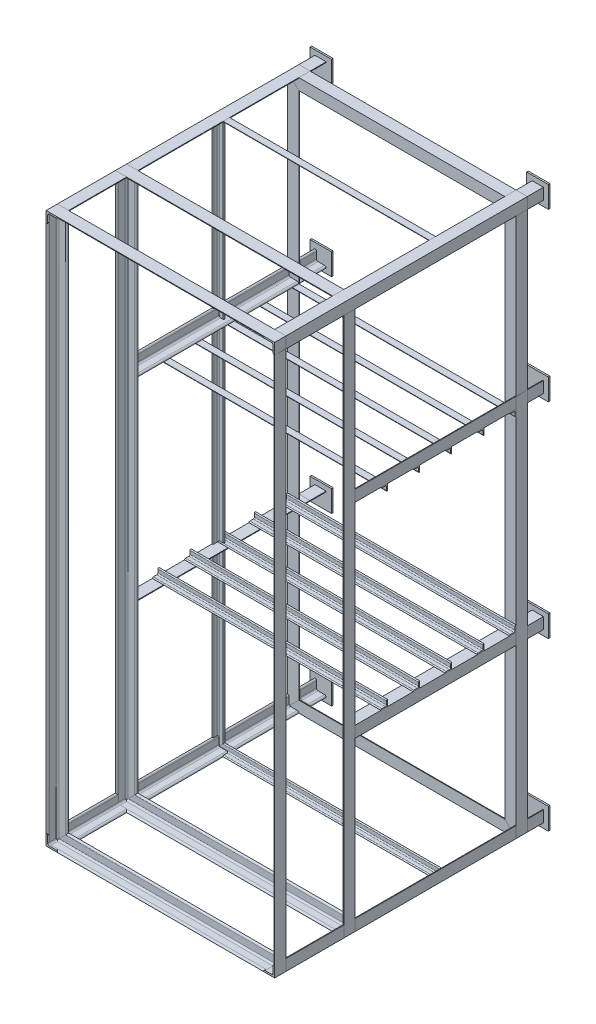
from build123d import *

# Parameters (mm, degrees)
ANGLE_IRON_35_X_35_X_5_3_DEPTH      = 795.497474683
ANGLE_IRON_35_X_35_X_5_3_DEPTH_BACK = 85.497474683
ANGLE_IRON_35_X_35_X_5_3_2_DEPTH    = 1880.994949366
ANGLE_IRON_35_X_35_X_5_3_3_DEPTH    = 880.994949366
ANGLE_IRON_35_X_35_X_5_3_4_DEPTH    = 1880.994949366
ANGLE_IRON_35_X_35_X_5_4_DEPTH      = 760.497474683
ANGLE_IRON_35_X_35_X_5_4_DEPTH_BACK = 50.497474683
ANGLE_IRON_35_X_35_X_5_4_2_DEPTH    = 1810.994949366
ANGLE_IRON_35_X_35_X_5_4_3_DEPTH    = 810.994949366
ANGLE_IRON_35_X_35_X_5_4_4_DEPTH    = 1810.994949366
ANGLE_IRON_35_X_35_X_5_5_DEPTH      = 1795.497474683
ANGLE_IRON_35_X_35_X_5_5_DEPTH_BACK = 85.497474683
ANGLE_IRON_35_X_35_X_5_5_2_DEPTH    = 880.994949366
ANGLE_IRON_35_X_35_X_5_5_3_DEPTH    = 1880.994949366
ANGLE_IRON_35_X_35_X_5_5_4_DEPTH    = 880.994949366
ANGLE_IRON_35_X_35_X_5_6_DEPTH      = 785
ANGLE_IRON_35_X_35_X_5_8_DEPTH      = 785
ANGLE_IRON_35_X_35_X_5_9_DEPTH      = 50
ANGLE_IRON_35_X_35_X_5_9_2_DEPTH    = 785
ANGLE_IRON_35_X_35_X_5_10_DEPTH     = 50
ANGLE_IRON_35_X_35_X_5_10_2_DEPTH   = 785
ANGLE_IRON_35_X_35_X_5_11_DEPTH     = 50
ANGLE_IRON_35_X_35_X_5_12_DEPTH     = 50
ANGLE_IRON_35_X_35_X_5_13_DEPTH     = 50
ANGLE_IRON_35_X_35_X_5_13_2_DEPTH   = 535
ANGLE_IRON_35_X_35_X_5_14_DEPTH     = 50
ANGLE_IRON_35_X_35_X_5_14_2_DEPTH   = 535
ANGLE_IRON_35_X_35_X_5_15_DEPTH     = 50
ANGLE_IRON_35_X_35_X_5_15_2_DEPTH   = 535
ANGLE_IRON_35_X_35_X_5_16_DEPTH     = 535
ANGLE_IRON_35_X_35_X_5_16_2_DEPTH   = 50
ANGLE_IRON_20_X_20_X_3_1_DEPTH      = 739.284271247
ANGLE_IRON_20_X_20_X_3_1_2_DEPTH    = 1768.568542495
ANGLE_IRON_20_X_20_X_3_1_3_DEPTH    = 739.284271247
ANGLE_IRON_20_X_20_X_3_2_DEPTH      = 710
ANGLE_IRON_20_X_20_X_3_2_2_DEPTH    = 710
ANGLE_IRON_20_X_20_X_3_2_3_DEPTH    = 710
ANGLE_IRON_20_X_20_X_3_2_4_DEPTH    = 710
ANGLE_IRON_20_X_20_X_3_2_5_DEPTH    = 710
ANGLE_IRON_20_X_20_X_3_3_DEPTH      = 710
ANGLE_IRON_20_X_20_X_3_3_2_DEPTH    = 710
ANGLE_IRON_20_X_20_X_3_3_3_DEPTH    = 710
ANGLE_IRON_20_X_20_X_3_3_4_DEPTH    = 710
ANGLE_IRON_20_X_20_X_3_3_5_DEPTH    = 710
SKETCH127_W                         = 67
SKETCH127_H                         = 67
BOSS_EXTRUDE1_DEPTH                 = 5
SKETCH129_W                         = 67
SKETCH129_H                         = 67
BOSS_EXTRUDE2_DEPTH                 = 5
SKETCH130_W                         = 67
SKETCH130_H                         = 67
BOSS_EXTRUDE3_DEPTH                 = 5
SKETCH131_W                         = 67
SKETCH131_H                         = 67
BOSS_EXTRUDE4_DEPTH                 = 5


with BuildPart() as part:
    # Sketch1 → Angle iron 35 X 35 X 5(3) (new, two sides: drawn at the far end of the back side and taken through both)
    with BuildSketch(Plane(origin=(355, -855, 750), x_dir=(0, 0, 1), z_dir=(-1, 0, 0)).offset(-ANGLE_IRON_35_X_35_X_5_3_DEPTH_BACK)):
        with BuildLine():
            Line((0, 0), (0, 35))
            ThreePointArc((0, 35), (3.535533906, 33.535533906), (5, 30))
            Line((5, 30), (5, 10))
            ThreePointArc((5, 10), (6.464466094, 6.464466094), (10, 5))
            Line((10, 5), (30, 5))
            ThreePointArc((30, 5), (33.535533906, 3.535533906), (35, 0))
            Line((35, 0), (0, 0))
        make_face()
    extrude(amount=ANGLE_IRON_35_X_35_X_5_3_DEPTH + ANGLE_IRON_35_X_35_X_5_3_DEPTH_BACK)

    # Angle iron 35 X 35 X 5(3) mitre 1
    split(bisect_by=Plane(origin=(355, -855, 785), x_dir=(0.707106781, -0.707106781, 0), z_dir=(-0.707106781, -0.707106781, 0)), keep=Keep.TOP)

    # Angle iron 35 X 35 X 5(3) mitre 2
    split(bisect_by=Plane(origin=(-355, -855, 785), x_dir=(0.707106781, 0.707106781, 0), z_dir=(0.707106781, -0.707106781, 0)), keep=Keep.TOP)


with BuildPart() as body_2:
    # Sketch1 on segment 2 (carried to segment 2) → Angle iron 35 X 35 X 5_3 2 (new body)
    with BuildSketch(Plane(origin=(-355, -940.497474683, 750), x_dir=(0, 0, 1), z_dir=(0, 1, 0))):
        with BuildLine():
            Line((0, 0), (0, 35))
            ThreePointArc((0, 35), (3.535533906, 33.535533906), (5, 30))
            Line((5, 30), (5, 10))
            ThreePointArc((5, 10), (6.464466094, 6.464466094), (10, 5))
            Line((10, 5), (30, 5))
            ThreePointArc((30, 5), (33.535533906, 3.535533906), (35, 0))
            Line((35, 0), (0, 0))
        make_face()
    extrude(amount=ANGLE_IRON_35_X_35_X_5_3_2_DEPTH)

    # Angle iron 35 X 35 X 5_3 2 mitre 1
    split(bisect_by=Plane(origin=(-355, 855, 785), x_dir=(0.707106781, -0.707106781, 0), z_dir=(-0.707106781, -0.707106781, 0)), keep=Keep.TOP)

    # Angle iron 35 X 35 X 5_3 2 mitre 2
    split(bisect_by=Plane(origin=(-355, -855, 785), x_dir=(-0.707106781, -0.707106781, 0), z_dir=(-0.707106781, 0.707106781, 0)), keep=Keep.TOP)


with BuildPart() as body_3:
    # Sketch1 on segment 3 (carried to segment 3) → Angle iron 35 X 35 X 5_3 3 (new body)
    with BuildSketch(Plane(origin=(-440.497474683, 855, 750), x_dir=(0, 0, 1), z_dir=(1, 0, 0))):
        with BuildLine():
            Line((0, 0), (0, 35))
            ThreePointArc((0, 35), (3.535533906, 33.535533906), (5, 30))
            Line((5, 30), (5, 10))
            ThreePointArc((5, 10), (6.464466094, 6.464466094), (10, 5))
            Line((10, 5), (30, 5))
            ThreePointArc((30, 5), (33.535533906, 3.535533906), (35, 0))
            Line((35, 0), (0, 0))
        make_face()
    extrude(amount=ANGLE_IRON_35_X_35_X_5_3_3_DEPTH)

    # Angle iron 35 X 35 X 5_3 3 mitre 1
    split(bisect_by=Plane(origin=(355, 855, 785), x_dir=(-0.707106781, -0.707106781, 0), z_dir=(-0.707106781, 0.707106781, 0)), keep=Keep.TOP)

    # Angle iron 35 X 35 X 5_3 3 mitre 2
    split(bisect_by=Plane(origin=(-355, 855, 785), x_dir=(-0.707106781, 0.707106781, 0), z_dir=(0.707106781, 0.707106781, 0)), keep=Keep.TOP)


with BuildPart() as body_4:
    # Sketch1 on segment 4 (carried to segment 4) → Angle iron 35 X 35 X 5_3 4 (new body)
    with BuildSketch(Plane(origin=(355, 940.497474683, 750), x_dir=(0, 0, 1), z_dir=(0, -1, 0))):
        with BuildLine():
            Line((0, 0), (0, 35))
            ThreePointArc((0, 35), (3.535533906, 33.535533906), (5, 30))
            Line((5, 30), (5, 10))
            ThreePointArc((5, 10), (6.464466094, 6.464466094), (10, 5))
            Line((10, 5), (30, 5))
            ThreePointArc((30, 5), (33.535533906, 3.535533906), (35, 0))
            Line((35, 0), (0, 0))
        make_face()
    extrude(amount=ANGLE_IRON_35_X_35_X_5_3_4_DEPTH)

    # Angle iron 35 X 35 X 5_3 4 mitre 1
    split(bisect_by=Plane(origin=(355, -855, 785), x_dir=(-0.707106781, 0.707106781, 0), z_dir=(0.707106781, 0.707106781, 0)), keep=Keep.TOP)

    # Angle iron 35 X 35 X 5_3 4 mitre 2
    split(bisect_by=Plane(origin=(355, 855, 785), x_dir=(0.707106781, 0.707106781, 0), z_dir=(0.707106781, -0.707106781, 0)), keep=Keep.TOP)


with BuildPart() as body_5:
    # Sketch17 → Angle iron 35 X 35 X 5(4) (new, two sides: drawn at the far end of the back side and taken through both)
    with BuildSketch(Plane(origin=(-355, -855, 535), x_dir=(0, 1, 0), z_dir=(1, 0, 0)).offset(-ANGLE_IRON_35_X_35_X_5_4_DEPTH_BACK)):
        with BuildLine():
            Line((0, 0), (0, 35))
            ThreePointArc((0, 35), (3.535533906, 33.535533906), (5, 30))
            Line((5, 30), (5, 10))
            ThreePointArc((5, 10), (6.464466094, 6.464466094), (10, 5))
            Line((10, 5), (30, 5))
            ThreePointArc((30, 5), (33.535533906, 3.535533906), (35, 0))
            Line((35, 0), (0, 0))
        make_face()
    extrude(amount=ANGLE_IRON_35_X_35_X_5_4_DEPTH + ANGLE_IRON_35_X_35_X_5_4_DEPTH_BACK)

    # Angle iron 35 X 35 X 5(4) mitre 1
    split(bisect_by=Plane(origin=(-355, -855, 535), x_dir=(0.707106781, 0.707106781, 0), z_dir=(0.707106781, -0.707106781, 0)), keep=Keep.TOP)

    # Angle iron 35 X 35 X 5(4) mitre 2
    split(bisect_by=Plane(origin=(355, -855, 535), x_dir=(0.707106781, -0.707106781, 0), z_dir=(-0.707106781, -0.707106781, 0)), keep=Keep.TOP)


with BuildPart() as body_6:
    # Sketch17 on segment 2 (carried to segment 2) → Angle iron 35 X 35 X 5_4 2 (new body)
    with BuildSketch(Plane(origin=(355, -905.497474683, 535), x_dir=(-1, 0, 0), z_dir=(0, 1, 0))):
        with BuildLine():
            Line((0, 0), (0, 35))
            ThreePointArc((0, 35), (3.535533906, 33.535533906), (5, 30))
            Line((5, 30), (5, 10))
            ThreePointArc((5, 10), (6.464466094, 6.464466094), (10, 5))
            Line((10, 5), (30, 5))
            ThreePointArc((30, 5), (33.535533906, 3.535533906), (35, 0))
            Line((35, 0), (0, 0))
        make_face()
    extrude(amount=ANGLE_IRON_35_X_35_X_5_4_2_DEPTH)

    # Angle iron 35 X 35 X 5_4 2 mitre 1
    split(bisect_by=Plane(origin=(355, -855, 535), x_dir=(-0.707106781, 0.707106781, 0), z_dir=(0.707106781, 0.707106781, 0)), keep=Keep.TOP)

    # Angle iron 35 X 35 X 5_4 2 mitre 2
    split(bisect_by=Plane(origin=(355, 855, 535), x_dir=(0.707106781, 0.707106781, 0), z_dir=(0.707106781, -0.707106781, 0)), keep=Keep.TOP)


with BuildPart() as body_7:
    # Sketch17 on segment 3 (carried to segment 3) → Angle iron 35 X 35 X 5_4 3 (new body)
    with BuildSketch(Plane(origin=(405.497474683, 855, 535), x_dir=(0, -1, 0), z_dir=(-1, 0, 0))):
        with BuildLine():
            Line((0, 0), (0, 35))
            ThreePointArc((0, 35), (3.535533906, 33.535533906), (5, 30))
            Line((5, 30), (5, 10))
            ThreePointArc((5, 10), (6.464466094, 6.464466094), (10, 5))
            Line((10, 5), (30, 5))
            ThreePointArc((30, 5), (33.535533906, 3.535533906), (35, 0))
            Line((35, 0), (0, 0))
        make_face()
    extrude(amount=ANGLE_IRON_35_X_35_X_5_4_3_DEPTH)

    # Angle iron 35 X 35 X 5_4 3 mitre 1
    split(bisect_by=Plane(origin=(355, 855, 535), x_dir=(-0.707106781, -0.707106781, 0), z_dir=(-0.707106781, 0.707106781, 0)), keep=Keep.TOP)

    # Angle iron 35 X 35 X 5_4 3 mitre 2
    split(bisect_by=Plane(origin=(-355, 855, 535), x_dir=(-0.707106781, 0.707106781, 0), z_dir=(0.707106781, 0.707106781, 0)), keep=Keep.TOP)


with BuildPart() as body_8:
    # Sketch17 on segment 4 (carried to segment 4) → Angle iron 35 X 35 X 5_4 4 (new body)
    with BuildSketch(Plane(origin=(-355, 905.497474683, 535), x_dir=(1, 0, 0), z_dir=(0, -1, 0))):
        with BuildLine():
            Line((0, 0), (0, 35))
            ThreePointArc((0, 35), (3.535533906, 33.535533906), (5, 30))
            Line((5, 30), (5, 10))
            ThreePointArc((5, 10), (6.464466094, 6.464466094), (10, 5))
            Line((10, 5), (30, 5))
            ThreePointArc((30, 5), (33.535533906, 3.535533906), (35, 0))
            Line((35, 0), (0, 0))
        make_face()
    extrude(amount=ANGLE_IRON_35_X_35_X_5_4_4_DEPTH)

    # Angle iron 35 X 35 X 5_4 4 mitre 1
    split(bisect_by=Plane(origin=(-355, 855, 535), x_dir=(0.707106781, -0.707106781, 0), z_dir=(-0.707106781, -0.707106781, 0)), keep=Keep.TOP)

    # Angle iron 35 X 35 X 5_4 4 mitre 2
    split(bisect_by=Plane(origin=(-355, -855, 535), x_dir=(-0.707106781, -0.707106781, 0), z_dir=(-0.707106781, 0.707106781, 0)), keep=Keep.TOP)


with BuildPart() as body_9:
    # Sketch18 → Angle iron 35 X 35 X 5(5) (new, two sides: drawn at the far end of the back side and taken through both)
    with BuildSketch(Plane(origin=(355, -855, 35), x_dir=(0, 0, -1), z_dir=(0, 1, 0)).offset(-ANGLE_IRON_35_X_35_X_5_5_DEPTH_BACK)):
        with BuildLine():
            Line((0, 0), (0, 35))
            ThreePointArc((0, 35), (3.535533906, 33.535533906), (5, 30))
            Line((5, 30), (5, 10))
            ThreePointArc((5, 10), (6.464466094, 6.464466094), (10, 5))
            Line((10, 5), (30, 5))
            ThreePointArc((30, 5), (33.535533906, 3.535533906), (35, 0))
            Line((35, 0), (0, 0))
        make_face()
    extrude(amount=ANGLE_IRON_35_X_35_X_5_5_DEPTH + ANGLE_IRON_35_X_35_X_5_5_DEPTH_BACK)

    # Angle iron 35 X 35 X 5(5) mitre 1
    split(bisect_by=Plane(origin=(355, -855, 0), x_dir=(-0.707106781, 0.707106781, 0), z_dir=(0.707106781, 0.707106781, 0)), keep=Keep.TOP)

    # Angle iron 35 X 35 X 5(5) mitre 2
    split(bisect_by=Plane(origin=(355, 855, 0), x_dir=(0.707106781, 0.707106781, 0), z_dir=(0.707106781, -0.707106781, 0)), keep=Keep.TOP)


with BuildPart() as body_10:
    # Sketch18 on segment 2 (carried to segment 2) → Angle iron 35 X 35 X 5_5 2 (new body)
    with BuildSketch(Plane(origin=(440.497474683, 855, 35), x_dir=(0, 0, -1), z_dir=(-1, 0, 0))):
        with BuildLine():
            Line((0, 0), (0, 35))
            ThreePointArc((0, 35), (3.535533906, 33.535533906), (5, 30))
            Line((5, 30), (5, 10))
            ThreePointArc((5, 10), (6.464466094, 6.464466094), (10, 5))
            Line((10, 5), (30, 5))
            ThreePointArc((30, 5), (33.535533906, 3.535533906), (35, 0))
            Line((35, 0), (0, 0))
        make_face()
    extrude(amount=ANGLE_IRON_35_X_35_X_5_5_2_DEPTH)

    # Angle iron 35 X 35 X 5_5 2 mitre 1
    split(bisect_by=Plane(origin=(-355, 855, 0), x_dir=(-0.707106781, 0.707106781, 0), z_dir=(0.707106781, 0.707106781, 0)), keep=Keep.TOP)

    # Angle iron 35 X 35 X 5_5 2 mitre 2
    split(bisect_by=Plane(origin=(355, 855, 0), x_dir=(-0.707106781, -0.707106781, 0), z_dir=(-0.707106781, 0.707106781, 0)), keep=Keep.TOP)


with BuildPart() as body_11:
    # Sketch18 on segment 3 (carried to segment 3) → Angle iron 35 X 35 X 5_5 3 (new body)
    with BuildSketch(Plane(origin=(-355, 940.497474683, 35), x_dir=(0, 0, -1), z_dir=(0, -1, 0))):
        with BuildLine():
            Line((0, 0), (0, 35))
            ThreePointArc((0, 35), (3.535533906, 33.535533906), (5, 30))
            Line((5, 30), (5, 10))
            ThreePointArc((5, 10), (6.464466094, 6.464466094), (10, 5))
            Line((10, 5), (30, 5))
            ThreePointArc((30, 5), (33.535533906, 3.535533906), (35, 0))
            Line((35, 0), (0, 0))
        make_face()
    extrude(amount=ANGLE_IRON_35_X_35_X_5_5_3_DEPTH)

    # Angle iron 35 X 35 X 5_5 3 mitre 1
    split(bisect_by=Plane(origin=(-355, -855, 0), x_dir=(-0.707106781, -0.707106781, 0), z_dir=(-0.707106781, 0.707106781, 0)), keep=Keep.TOP)

    # Angle iron 35 X 35 X 5_5 3 mitre 2
    split(bisect_by=Plane(origin=(-355, 855, 0), x_dir=(0.707106781, -0.707106781, 0), z_dir=(-0.707106781, -0.707106781, 0)), keep=Keep.TOP)


with BuildPart() as body_12:
    # Sketch18 on segment 4 (carried to segment 4) → Angle iron 35 X 35 X 5_5 4 (new body)
    with BuildSketch(Plane(origin=(-440.497474683, -855, 35), x_dir=(0, 0, -1), z_dir=(1, 0, 0))):
        with BuildLine():
            Line((0, 0), (0, 35))
            ThreePointArc((0, 35), (3.535533906, 33.535533906), (5, 30))
            Line((5, 30), (5, 10))
            ThreePointArc((5, 10), (6.464466094, 6.464466094), (10, 5))
            Line((10, 5), (30, 5))
            ThreePointArc((30, 5), (33.535533906, 3.535533906), (35, 0))
            Line((35, 0), (0, 0))
        make_face()
    extrude(amount=ANGLE_IRON_35_X_35_X_5_5_4_DEPTH)

    # Angle iron 35 X 35 X 5_5 4 mitre 1
    split(bisect_by=Plane(origin=(-355, -855, 0), x_dir=(0.707106781, 0.707106781, 0), z_dir=(0.707106781, -0.707106781, 0)), keep=Keep.TOP)

    # Angle iron 35 X 35 X 5_5 4 mitre 2
    split(bisect_by=Plane(origin=(355, -855, 0), x_dir=(0.707106781, -0.707106781, 0), z_dir=(-0.707106781, -0.707106781, 0)), keep=Keep.TOP)


with BuildPart() as body_13:
    # Sketch112 → Angle iron 35 X 35 X 5(6) (new body)
    with BuildSketch(Plane(origin=(355, -855, 0), x_dir=(0, 1, 0), z_dir=(0, 0, 1))):
        with BuildLine():
            Line((0, 0), (0, 35))
            ThreePointArc((0, 35), (3.535533906, 33.535533906), (5, 30))
            Line((5, 30), (5, 10))
            ThreePointArc((5, 10), (6.464466094, 6.464466094), (10, 5))
            Line((10, 5), (30, 5))
            ThreePointArc((30, 5), (33.535533906, 3.535533906), (35, 0))
            Line((35, 0), (0, 0))
        make_face()
    extrude(amount=ANGLE_IRON_35_X_35_X_5_6_DEPTH)


with BuildPart() as body_14:
    # Sketch113 → Angle iron 35 X 35 X 5(8) (new body)
    with BuildSketch(Plane(origin=(-355, -855, 0), x_dir=(1, 0, 0), z_dir=(0, 0, 1))):
        with BuildLine():
            Line((0, 0), (0, 35))
            ThreePointArc((0, 35), (3.535533906, 33.535533906), (5, 30))
            Line((5, 30), (5, 10))
            ThreePointArc((5, 10), (6.464466094, 6.464466094), (10, 5))
            Line((10, 5), (30, 5))
            ThreePointArc((30, 5), (33.535533906, 3.535533906), (35, 0))
            Line((35, 0), (0, 0))
        make_face()
    extrude(amount=ANGLE_IRON_35_X_35_X_5_8_DEPTH)


with BuildPart() as body_15:
    # Sketch114 on segment 1 (carried to segment 1) → Angle iron 35 X 35 X 5(9) (new body)
    with BuildSketch(Plane(origin=(-355, 855, 0), x_dir=(1, 0, 0), z_dir=(0, 0, -1))):
        with BuildLine():
            Line((0, 0), (0, 35))
            ThreePointArc((0, 35), (3.535533906, 33.535533906), (5, 30))
            Line((5, 30), (5, 10))
            ThreePointArc((5, 10), (6.464466094, 6.464466094), (10, 5))
            Line((10, 5), (30, 5))
            ThreePointArc((30, 5), (33.535533906, 3.535533906), (35, 0))
            Line((35, 0), (0, 0))
        make_face()
    extrude(amount=ANGLE_IRON_35_X_35_X_5_9_DEPTH)


with BuildPart() as body_16:
    # Sketch114 → Angle iron 35 X 35 X 5_9 2 (new body)
    with BuildSketch(Plane(origin=(-355, 855, 0), x_dir=(1, 0, 0), z_dir=(0, 0, -1))):
        with BuildLine():
            Line((0, 0), (0, 35))
            ThreePointArc((0, 35), (3.535533906, 33.535533906), (5, 30))
            Line((5, 30), (5, 10))
            ThreePointArc((5, 10), (6.464466094, 6.464466094), (10, 5))
            Line((10, 5), (30, 5))
            ThreePointArc((30, 5), (33.535533906, 3.535533906), (35, 0))
            Line((35, 0), (0, 0))
        make_face()
    extrude(amount=-ANGLE_IRON_35_X_35_X_5_9_2_DEPTH)


with BuildPart() as body_17:
    # Sketch115 → Angle iron 35 X 35 X 5(10) (new body)
    with BuildSketch(Plane(origin=(355, 855, 0), x_dir=(-1, 0, 0), z_dir=(0, 0, 1))):
        with BuildLine():
            Line((0, 0), (0, 35))
            ThreePointArc((0, 35), (3.535533906, 33.535533906), (5, 30))
            Line((5, 30), (5, 10))
            ThreePointArc((5, 10), (6.464466094, 6.464466094), (10, 5))
            Line((10, 5), (30, 5))
            ThreePointArc((30, 5), (33.535533906, 3.535533906), (35, 0))
            Line((35, 0), (0, 0))
        make_face()
    extrude(amount=-ANGLE_IRON_35_X_35_X_5_10_DEPTH)


with BuildPart() as body_18:
    # Sketch115 on segment 2 (carried to segment 2) → Angle iron 35 X 35 X 5_10 2 (new body)
    with BuildSketch(Plane(origin=(355, 855, 0), x_dir=(-1, 0, 0), z_dir=(0, 0, 1))):
        with BuildLine():
            Line((0, 0), (0, 35))
            ThreePointArc((0, 35), (3.535533906, 33.535533906), (5, 30))
            Line((5, 30), (5, 10))
            ThreePointArc((5, 10), (6.464466094, 6.464466094), (10, 5))
            Line((10, 5), (30, 5))
            ThreePointArc((30, 5), (33.535533906, 3.535533906), (35, 0))
            Line((35, 0), (0, 0))
        make_face()
    extrude(amount=ANGLE_IRON_35_X_35_X_5_10_2_DEPTH)


with BuildPart() as body_19:
    # Sketch116 → Angle iron 35 X 35 X 5(11) (new body)
    with BuildSketch(Plane(origin=(355, -855, 0), x_dir=(-1, 0, 0), z_dir=(0, 0, -1))):
        with BuildLine():
            Line((0, 0), (0, 35))
            ThreePointArc((0, 35), (3.535533906, 33.535533906), (5, 30))
            Line((5, 30), (5, 10))
            ThreePointArc((5, 10), (6.464466094, 6.464466094), (10, 5))
            Line((10, 5), (30, 5))
            ThreePointArc((30, 5), (33.535533906, 3.535533906), (35, 0))
            Line((35, 0), (0, 0))
        make_face()
    extrude(amount=ANGLE_IRON_35_X_35_X_5_11_DEPTH)


with BuildPart() as body_20:
    # Sketch117 → Angle iron 35 X 35 X 5(12) (new body)
    with BuildSketch(Plane(origin=(-355, -855, 0), x_dir=(0, 1, 0), z_dir=(0, 0, -1))):
        with BuildLine():
            Line((0, 0), (0, 35))
            ThreePointArc((0, 35), (3.535533906, 33.535533906), (5, 30))
            Line((5, 30), (5, 10))
            ThreePointArc((5, 10), (6.464466094, 6.464466094), (10, 5))
            Line((10, 5), (30, 5))
            ThreePointArc((30, 5), (33.535533906, 3.535533906), (35, 0))
            Line((35, 0), (0, 0))
        make_face()
    extrude(amount=ANGLE_IRON_35_X_35_X_5_12_DEPTH)


with BuildPart() as body_21:
    # Sketch118 → Angle iron 35 X 35 X 5(13) (new body)
    with BuildSketch(Plane(origin=(355, -300, 0), x_dir=(-1, 0, 0), z_dir=(0, 0, 1))):
        with BuildLine():
            Line((0, 0), (0, 35))
            ThreePointArc((0, 35), (3.535533906, 33.535533906), (5, 30))
            Line((5, 30), (5, 10))
            ThreePointArc((5, 10), (6.464466094, 6.464466094), (10, 5))
            Line((10, 5), (30, 5))
            ThreePointArc((30, 5), (33.535533906, 3.535533906), (35, 0))
            Line((35, 0), (0, 0))
        make_face()
    extrude(amount=-ANGLE_IRON_35_X_35_X_5_13_DEPTH)


with BuildPart() as body_22:
    # Sketch118 on segment 2 (carried to segment 2) → Angle iron 35 X 35 X 5_13 2 (new body)
    with BuildSketch(Plane(origin=(355, -300, 0), x_dir=(-1, 0, 0), z_dir=(0, 0, 1))):
        with BuildLine():
            Line((0, 0), (0, 35))
            ThreePointArc((0, 35), (3.535533906, 33.535533906), (5, 30))
            Line((5, 30), (5, 10))
            ThreePointArc((5, 10), (6.464466094, 6.464466094), (10, 5))
            Line((10, 5), (30, 5))
            ThreePointArc((30, 5), (33.535533906, 3.535533906), (35, 0))
            Line((35, 0), (0, 0))
        make_face()
    extrude(amount=ANGLE_IRON_35_X_35_X_5_13_2_DEPTH)


with BuildPart() as body_23:
    # Sketch119 → Angle iron 35 X 35 X 5(14) (new body)
    with BuildSketch(Plane(origin=(355, 300, 0), x_dir=(0, 1, 0), z_dir=(0, 0, 1))):
        with BuildLine():
            Line((0, 0), (0, 35))
            ThreePointArc((0, 35), (3.535533906, 33.535533906), (5, 30))
            Line((5, 30), (5, 10))
            ThreePointArc((5, 10), (6.464466094, 6.464466094), (10, 5))
            Line((10, 5), (30, 5))
            ThreePointArc((30, 5), (33.535533906, 3.535533906), (35, 0))
            Line((35, 0), (0, 0))
        make_face()
    extrude(amount=-ANGLE_IRON_35_X_35_X_5_14_DEPTH)


with BuildPart() as body_24:
    # Sketch119 on segment 2 (carried to segment 2) → Angle iron 35 X 35 X 5_14 2 (new body)
    with BuildSketch(Plane(origin=(355, 300, 0), x_dir=(0, 1, 0), z_dir=(0, 0, 1))):
        with BuildLine():
            Line((0, 0), (0, 35))
            ThreePointArc((0, 35), (3.535533906, 33.535533906), (5, 30))
            Line((5, 30), (5, 10))
            ThreePointArc((5, 10), (6.464466094, 6.464466094), (10, 5))
            Line((10, 5), (30, 5))
            ThreePointArc((30, 5), (33.535533906, 3.535533906), (35, 0))
            Line((35, 0), (0, 0))
        make_face()
    extrude(amount=ANGLE_IRON_35_X_35_X_5_14_2_DEPTH)


with BuildPart() as body_25:
    # Sketch120 → Angle iron 35 X 35 X 5(15) (new body)
    with BuildSketch(Plane(origin=(-355, 300, 0), x_dir=(1, 0, 0), z_dir=(0, 0, 1))):
        with BuildLine():
            Line((0, 0), (0, 35))
            ThreePointArc((0, 35), (3.535533906, 33.535533906), (5, 30))
            Line((5, 30), (5, 10))
            ThreePointArc((5, 10), (6.464466094, 6.464466094), (10, 5))
            Line((10, 5), (30, 5))
            ThreePointArc((30, 5), (33.535533906, 3.535533906), (35, 0))
            Line((35, 0), (0, 0))
        make_face()
    extrude(amount=-ANGLE_IRON_35_X_35_X_5_15_DEPTH)


with BuildPart() as body_26:
    # Sketch120 on segment 2 (carried to segment 2) → Angle iron 35 X 35 X 5_15 2 (new body)
    with BuildSketch(Plane(origin=(-355, 300, 0), x_dir=(1, 0, 0), z_dir=(0, 0, 1))):
        with BuildLine():
            Line((0, 0), (0, 35))
            ThreePointArc((0, 35), (3.535533906, 33.535533906), (5, 30))
            Line((5, 30), (5, 10))
            ThreePointArc((5, 10), (6.464466094, 6.464466094), (10, 5))
            Line((10, 5), (30, 5))
            ThreePointArc((30, 5), (33.535533906, 3.535533906), (35, 0))
            Line((35, 0), (0, 0))
        make_face()
    extrude(amount=ANGLE_IRON_35_X_35_X_5_15_2_DEPTH)


with BuildPart() as body_27:
    # Sketch121 → Angle iron 35 X 35 X 5(16) (new body)
    with BuildSketch(Plane(origin=(-355, -300, 535), x_dir=(1, 0, 0), z_dir=(0, 0, -1))):
        with BuildLine():
            Line((0, 0), (0, 35))
            ThreePointArc((0, 35), (3.535533906, 33.535533906), (5, 30))
            Line((5, 30), (5, 10))
            ThreePointArc((5, 10), (6.464466094, 6.464466094), (10, 5))
            Line((10, 5), (30, 5))
            ThreePointArc((30, 5), (33.535533906, 3.535533906), (35, 0))
            Line((35, 0), (0, 0))
        make_face()
    extrude(amount=ANGLE_IRON_35_X_35_X_5_16_DEPTH)


with BuildPart() as body_28:
    # Sketch121 on segment 2 (carried to segment 2) → Angle iron 35 X 35 X 5_16 2 (new body)
    with BuildSketch(Plane(origin=(-355, -300, 0), x_dir=(1, 0, 0), z_dir=(0, 0, -1))):
        with BuildLine():
            Line((0, 0), (0, 35))
            ThreePointArc((0, 35), (3.535533906, 33.535533906), (5, 30))
            Line((5, 30), (5, 10))
            ThreePointArc((5, 10), (6.464466094, 6.464466094), (10, 5))
            Line((10, 5), (30, 5))
            ThreePointArc((30, 5), (33.535533906, 3.535533906), (35, 0))
            Line((35, 0), (0, 0))
        make_face()
    extrude(amount=ANGLE_IRON_35_X_35_X_5_16_2_DEPTH)


with BuildPart() as body_29:
    # Sketch124 → Angle iron 20 X 20 X 3(1) (new body)
    with BuildSketch(Plane(origin=(355, -855, 250), x_dir=(0, 0, 1), z_dir=(-1, 0, 0))):
        with BuildLine():
            Line((0, 0), (0, 20))
            ThreePointArc((0, 20), (2.121320344, 19.121320344), (3, 17))
            Line((3, 17), (3, 6.5))
            ThreePointArc((3, 6.5), (4.025126266, 4.025126266), (6.5, 3))
            Line((6.5, 3), (17, 3))
            ThreePointArc((17, 3), (19.121320344, 2.121320344), (20, 0))
            Line((20, 0), (0, 0))
        make_face()
    extrude(amount=ANGLE_IRON_20_X_20_X_3_1_DEPTH)

    # Angle iron 20 X 20 X 3(1) mitre 1
    split(bisect_by=Plane(origin=(-355, -855, 250), x_dir=(0.707106781, 0.707106781, 0), z_dir=(0.707106781, -0.707106781, 0)), keep=Keep.TOP)


with BuildPart() as body_30:
    # Sketch124 on segment 2 (carried to segment 2) → Angle iron 20 X 20 X 3_1 2 (new body)
    with BuildSketch(Plane(origin=(-355, -884.284271247, 250), x_dir=(0, 0, 1), z_dir=(0, 1, 0))):
        with BuildLine():
            Line((0, 0), (0, 20))
            ThreePointArc((0, 20), (2.121320344, 19.121320344), (3, 17))
            Line((3, 17), (3, 6.5))
            ThreePointArc((3, 6.5), (4.025126266, 4.025126266), (6.5, 3))
            Line((6.5, 3), (17, 3))
            ThreePointArc((17, 3), (19.121320344, 2.121320344), (20, 0))
            Line((20, 0), (0, 0))
        make_face()
    extrude(amount=ANGLE_IRON_20_X_20_X_3_1_2_DEPTH)

    # Angle iron 20 X 20 X 3_1 2 mitre 1
    split(bisect_by=Plane(origin=(-355, -855, 250), x_dir=(-0.707106781, -0.707106781, 0), z_dir=(-0.707106781, 0.707106781, 0)), keep=Keep.TOP)

    # Angle iron 20 X 20 X 3_1 2 mitre 2
    split(bisect_by=Plane(origin=(-355, 855, 250), x_dir=(0.707106781, -0.707106781, 0), z_dir=(-0.707106781, -0.707106781, 0)), keep=Keep.TOP)


with BuildPart() as body_31:
    # Sketch124 on segment 3 (carried to segment 3) → Angle iron 20 X 20 X 3_1 3 (new body)
    with BuildSketch(Plane(origin=(-384.284271247, 855, 250), x_dir=(0, 0, 1), z_dir=(1, 0, 0))):
        with BuildLine():
            Line((0, 0), (0, 20))
            ThreePointArc((0, 20), (2.121320344, 19.121320344), (3, 17))
            Line((3, 17), (3, 6.5))
            ThreePointArc((3, 6.5), (4.025126266, 4.025126266), (6.5, 3))
            Line((6.5, 3), (17, 3))
            ThreePointArc((17, 3), (19.121320344, 2.121320344), (20, 0))
            Line((20, 0), (0, 0))
        make_face()
    extrude(amount=ANGLE_IRON_20_X_20_X_3_1_3_DEPTH)

    # Angle iron 20 X 20 X 3_1 3 mitre 1
    split(bisect_by=Plane(origin=(-355, 855, 250), x_dir=(-0.707106781, 0.707106781, 0), z_dir=(0.707106781, 0.707106781, 0)), keep=Keep.TOP)


with BuildPart() as body_32:
    # Sketch125 → Angle iron 20 X 20 X 3(2) (new body)
    with BuildSketch(Plane(origin=(355, -300, 435), x_dir=(0, 0, 1), z_dir=(-1, 0, 0))):
        with BuildLine():
            Line((0, 0), (0, 20))
            ThreePointArc((0, 20), (2.121320344, 19.121320344), (3, 17))
            Line((3, 17), (3, 6.5))
            ThreePointArc((3, 6.5), (4.025126266, 4.025126266), (6.5, 3))
            Line((6.5, 3), (17, 3))
            ThreePointArc((17, 3), (19.121320344, 2.121320344), (20, 0))
            Line((20, 0), (0, 0))
        make_face()
    extrude(amount=ANGLE_IRON_20_X_20_X_3_2_DEPTH)


with BuildPart() as body_33:
    # Sketch125 on segment 2 (carried to segment 2) → Angle iron 20 X 20 X 3_2 2 (new body)
    with BuildSketch(Plane(origin=(355, -300, 335), x_dir=(0, 0, 1), z_dir=(-1, 0, 0))):
        with BuildLine():
            Line((0, 0), (0, 20))
            ThreePointArc((0, 20), (2.121320344, 19.121320344), (3, 17))
            Line((3, 17), (3, 6.5))
            ThreePointArc((3, 6.5), (4.025126266, 4.025126266), (6.5, 3))
            Line((6.5, 3), (17, 3))
            ThreePointArc((17, 3), (19.121320344, 2.121320344), (20, 0))
            Line((20, 0), (0, 0))
        make_face()
    extrude(amount=ANGLE_IRON_20_X_20_X_3_2_2_DEPTH)


with BuildPart() as body_34:
    # Sketch125 on segment 3 (carried to segment 3) → Angle iron 20 X 20 X 3_2 3 (new body)
    with BuildSketch(Plane(origin=(355, -300, 235), x_dir=(0, 0, 1), z_dir=(-1, 0, 0))):
        with BuildLine():
            Line((0, 0), (0, 20))
            ThreePointArc((0, 20), (2.121320344, 19.121320344), (3, 17))
            Line((3, 17), (3, 6.5))
            ThreePointArc((3, 6.5), (4.025126266, 4.025126266), (6.5, 3))
            Line((6.5, 3), (17, 3))
            ThreePointArc((17, 3), (19.121320344, 2.121320344), (20, 0))
            Line((20, 0), (0, 0))
        make_face()
    extrude(amount=ANGLE_IRON_20_X_20_X_3_2_3_DEPTH)


with BuildPart() as body_35:
    # Sketch125 on segment 4 (carried to segment 4) → Angle iron 20 X 20 X 3_2 4 (new body)
    with BuildSketch(Plane(origin=(355, -300, 135), x_dir=(0, 0, 1), z_dir=(-1, 0, 0))):
        with BuildLine():
            Line((0, 0), (0, 20))
            ThreePointArc((0, 20), (2.121320344, 19.121320344), (3, 17))
            Line((3, 17), (3, 6.5))
            ThreePointArc((3, 6.5), (4.025126266, 4.025126266), (6.5, 3))
            Line((6.5, 3), (17, 3))
            ThreePointArc((17, 3), (19.121320344, 2.121320344), (20, 0))
            Line((20, 0), (0, 0))
        make_face()
    extrude(amount=ANGLE_IRON_20_X_20_X_3_2_4_DEPTH)


with BuildPart() as body_36:
    # Sketch125 on segment 5 (carried to segment 5) → Angle iron 20 X 20 X 3_2 5 (new body)
    with BuildSketch(Plane(origin=(355, -300, 35), x_dir=(0, 0, 1), z_dir=(-1, 0, 0))):
        with BuildLine():
            Line((0, 0), (0, 20))
            ThreePointArc((0, 20), (2.121320344, 19.121320344), (3, 17))
            Line((3, 17), (3, 6.5))
            ThreePointArc((3, 6.5), (4.025126266, 4.025126266), (6.5, 3))
            Line((6.5, 3), (17, 3))
            ThreePointArc((17, 3), (19.121320344, 2.121320344), (20, 0))
            Line((20, 0), (0, 0))
        make_face()
    extrude(amount=ANGLE_IRON_20_X_20_X_3_2_5_DEPTH)


with BuildPart() as body_37:
    # Sketch126 → Angle iron 20 X 20 X 3(3) (new body)
    with BuildSketch(Plane(origin=(-355, 300, 435), x_dir=(0, 0, 1), z_dir=(1, 0, 0))):
        with BuildLine():
            Line((0, 0), (0, 20))
            ThreePointArc((0, 20), (2.121320344, 19.121320344), (3, 17))
            Line((3, 17), (3, 6.5))
            ThreePointArc((3, 6.5), (4.025126266, 4.025126266), (6.5, 3))
            Line((6.5, 3), (17, 3))
            ThreePointArc((17, 3), (19.121320344, 2.121320344), (20, 0))
            Line((20, 0), (0, 0))
        make_face()
    extrude(amount=ANGLE_IRON_20_X_20_X_3_3_DEPTH)


with BuildPart() as body_38:
    # Sketch126 on segment 2 (carried to segment 2) → Angle iron 20 X 20 X 3_3 2 (new body)
    with BuildSketch(Plane(origin=(-355, 300, 335), x_dir=(0, 0, 1), z_dir=(1, 0, 0))):
        with BuildLine():
            Line((0, 0), (0, 20))
            ThreePointArc((0, 20), (2.121320344, 19.121320344), (3, 17))
            Line((3, 17), (3, 6.5))
            ThreePointArc((3, 6.5), (4.025126266, 4.025126266), (6.5, 3))
            Line((6.5, 3), (17, 3))
            ThreePointArc((17, 3), (19.121320344, 2.121320344), (20, 0))
            Line((20, 0), (0, 0))
        make_face()
    extrude(amount=ANGLE_IRON_20_X_20_X_3_3_2_DEPTH)


with BuildPart() as body_39:
    # Sketch126 on segment 3 (carried to segment 3) → Angle iron 20 X 20 X 3_3 3 (new body)
    with BuildSketch(Plane(origin=(-355, 300, 235), x_dir=(0, 0, 1), z_dir=(1, 0, 0))):
        with BuildLine():
            Line((0, 0), (0, 20))
            ThreePointArc((0, 20), (2.121320344, 19.121320344), (3, 17))
            Line((3, 17), (3, 6.5))
            ThreePointArc((3, 6.5), (4.025126266, 4.025126266), (6.5, 3))
            Line((6.5, 3), (17, 3))
            ThreePointArc((17, 3), (19.121320344, 2.121320344), (20, 0))
            Line((20, 0), (0, 0))
        make_face()
    extrude(amount=ANGLE_IRON_20_X_20_X_3_3_3_DEPTH)


with BuildPart() as body_40:
    # Sketch126 on segment 4 (carried to segment 4) → Angle iron 20 X 20 X 3_3 4 (new body)
    with BuildSketch(Plane(origin=(-355, 300, 135), x_dir=(0, 0, 1), z_dir=(1, 0, 0))):
        with BuildLine():
            Line((0, 0), (0, 20))
            ThreePointArc((0, 20), (2.121320344, 19.121320344), (3, 17))
            Line((3, 17), (3, 6.5))
            ThreePointArc((3, 6.5), (4.025126266, 4.025126266), (6.5, 3))
            Line((6.5, 3), (17, 3))
            ThreePointArc((17, 3), (19.121320344, 2.121320344), (20, 0))
            Line((20, 0), (0, 0))
        make_face()
    extrude(amount=ANGLE_IRON_20_X_20_X_3_3_4_DEPTH)


with BuildPart() as body_41:
    # Sketch126 on segment 5 (carried to segment 5) → Angle iron 20 X 20 X 3_3 5 (new body)
    with BuildSketch(Plane(origin=(-355, 300, 35), x_dir=(0, 0, 1), z_dir=(1, 0, 0))):
        with BuildLine():
            Line((0, 0), (0, 20))
            ThreePointArc((0, 20), (2.121320344, 19.121320344), (3, 17))
            Line((3, 17), (3, 6.5))
            ThreePointArc((3, 6.5), (4.025126266, 4.025126266), (6.5, 3))
            Line((6.5, 3), (17, 3))
            ThreePointArc((17, 3), (19.121320344, 2.121320344), (20, 0))
            Line((20, 0), (0, 0))
        make_face()
    extrude(amount=ANGLE_IRON_20_X_20_X_3_3_5_DEPTH)


with BuildPart() as body_42:
    # Sketch127 → Boss-Extrude1 (new body)
    with BuildSketch(Plane(origin=(0, 0, -50), x_dir=(1, 0, 0), z_dir=(0, 0, -1))):
        with Locations((336.5, 836.5)):
            Rectangle(SKETCH127_W, SKETCH127_H)
    boss_extrude1 = extrude(amount=BOSS_EXTRUDE1_DEPTH)


with BuildPart() as body_43:
    # Sketch129 → Boss-Extrude2 (new body)
    with BuildSketch(Plane(origin=(0, 0, -50), x_dir=(1, 0, 0), z_dir=(0, 0, -1))):
        with Locations((336.5, 318.5)):
            Rectangle(SKETCH129_W, SKETCH129_H)
    boss_extrude2 = extrude(amount=BOSS_EXTRUDE2_DEPTH)


with BuildPart() as body_44:
    # Sketch130 → Boss-Extrude3 (new body)
    with BuildSketch(Plane(origin=(0, 0, -50), x_dir=(1, 0, 0), z_dir=(0, 0, -1))):
        with Locations((336.5, -318.5)):
            Rectangle(SKETCH130_W, SKETCH130_H)
    boss_extrude3 = extrude(amount=BOSS_EXTRUDE3_DEPTH)


with BuildPart() as body_45:
    # Sketch131 → Boss-Extrude4 (new body)
    with BuildSketch(Plane(origin=(0, 0, -50), x_dir=(1, 0, 0), z_dir=(0, 0, -1))):
        with Locations((336.5, -836.5)):
            Rectangle(SKETCH131_W, SKETCH131_H)
    boss_extrude4 = extrude(amount=BOSS_EXTRUDE4_DEPTH)


with BuildPart() as body_15_1:
    add(body_15.part)

    add(body_20.part)  # Mirror1 merges body 20

    add(body_25.part)  # Mirror1 merges body 25

    add(body_28.part)  # Mirror1 merges body 28
    # Mirror1: Boss-Extrude1, Boss-Extrude2, Boss-Extrude3, Boss-Extrude4 across plane
    add(boss_extrude1.mirror(Plane(origin=(0, 0, 0), x_dir=(0, 0, 1), z_dir=(1, 0, 0))))
    add(boss_extrude2.mirror(Plane(origin=(0, 0, 0), x_dir=(0, 0, 1), z_dir=(1, 0, 0))))
    add(boss_extrude3.mirror(Plane(origin=(0, 0, 0), x_dir=(0, 0, 1), z_dir=(1, 0, 0))))
    add(boss_extrude4.mirror(Plane(origin=(0, 0, 0), x_dir=(0, 0, 1), z_dir=(1, 0, 0))))


solid = Compound([part.part, body_2.part, body_3.part, body_4.part, body_5.part, body_6.part, body_7.part, body_8.part, body_9.part, body_10.part, body_11.part, body_12.part, body_13.part, body_14.part, body_16.part, body_17.part, body_18.part, body_19.part, body_21.part, body_22.part, body_23.part, body_24.part, body_26.part, body_27.part, body_29.part, body_30.part, body_31.part, body_32.part, body_33.part, body_34.part, body_35.part, body_36.part, body_37.part, body_38.part, body_39.part, body_40.part, body_41.part, body_42.part, body_43.part, body_44.part, body_45.part, body_15_1.part])
